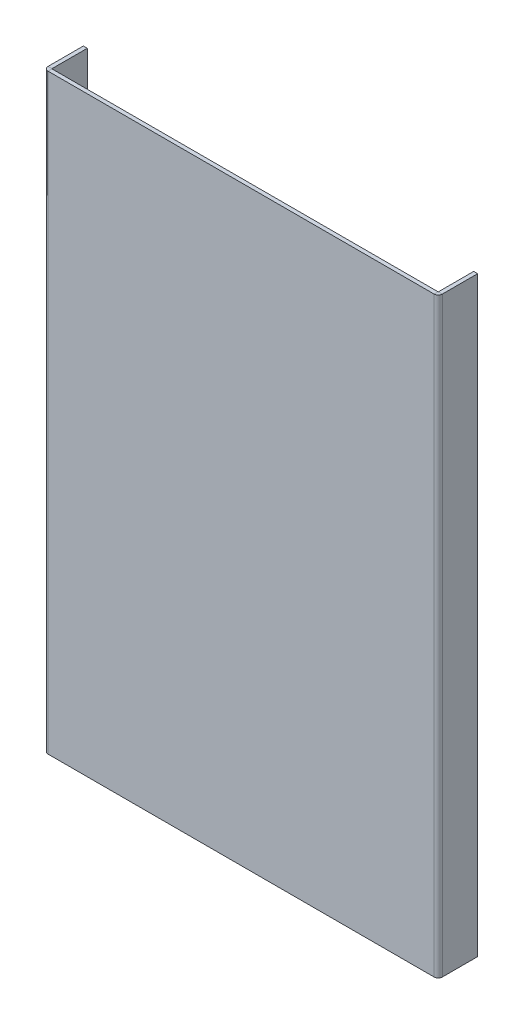
from build123d import *

# Parameters (mm, degrees)
SKETCH_1_W                         = 200
SKETCH_1_H                         = 300
SM_BASE_FLANGE_1_DEPTH             = 2
SM_EDGE_FLANGE_1_STRIP_W           = 8.2
SM_EDGE_FLANGE_1_STRIP_H           = 2
SM_EDGE_FLANGE_1_STRIP_CUT_DEPTH   = 300
SM_EDGE_FLANGE_1_STRIP_2_W         = 8.2
SM_EDGE_FLANGE_1_STRIP_2_H         = 2
SM_EDGE_FLANGE_1_STRIP_CUT_2_DEPTH = 300
SM_EDGE_FLANGE_1_DEPTH             = 300
SM_EDGE_FLANGE_1_BEND_DEPTH        = 300


# Sheet-metal steps are written as plain solids
with BuildPart() as part:
    # Sketch 1 → 基体-法兰1 (new body)
    with BuildSketch(Plane.XY):
        Rectangle(SKETCH_1_W, SKETCH_1_H)
    extrude(amount=-SM_BASE_FLANGE_1_DEPTH)

    # 边线-法兰1 strip (across the edge) → 边线-法兰1 strip cut (cut)
    with BuildSketch(Plane(origin=(100, 150, -2), x_dir=(-1, 0, 0), z_dir=(0, -1, 0))):
        with Locations((-2, -1)):
            Rectangle(SM_EDGE_FLANGE_1_STRIP_W, SM_EDGE_FLANGE_1_STRIP_H)
    extrude(amount=SM_EDGE_FLANGE_1_STRIP_CUT_DEPTH, mode=Mode.SUBTRACT)

    # 边线-法兰1 strip 2 (across the edge) → 边线-法兰1 strip cut 2 (cut)
    with BuildSketch(Plane(origin=(-100, -150, -2), x_dir=(1, 0, 0), z_dir=(0, 1, 0))):
        with Locations((-2, -1)):
            Rectangle(SM_EDGE_FLANGE_1_STRIP_2_W, SM_EDGE_FLANGE_1_STRIP_2_H)
    extrude(amount=SM_EDGE_FLANGE_1_STRIP_CUT_2_DEPTH, mode=Mode.SUBTRACT)

    # 边线-法兰1 section (across the edge) → 边线-法兰1 (add)
    with BuildSketch(Plane(origin=(100, 150, -2), x_dir=(-1, 0, 0), z_dir=(0, -1, 0))):
        with BuildLine():
            Line((0, 0.1), (0, 18))
            Line((0, 18), (2, 18))
            Line((2, 18), (2, 0.1))
            ThreePointArc((2, 0.1), (2.029289322, 0.029289322), (2.1, 0))
            Line((2.1, 0), (2.1, -2))
            ThreePointArc((2.1, -2), (0.61507576, -1.38492424), (0, 0.1))
        make_face()
    extrude(amount=SM_EDGE_FLANGE_1_DEPTH)

    # 边线-法兰1 section 2 (across the edge) → 边线-法兰1 bend (add)
    with BuildSketch(Plane(origin=(-100, -150, -2), x_dir=(1, 0, 0), z_dir=(0, 1, 0))):
        with BuildLine():
            Line((0, 0.1), (0, 18))
            Line((0, 18), (2, 18))
            Line((2, 18), (2, 0.1))
            ThreePointArc((2, 0.1), (2.029289322, 0.029289322), (2.1, 0))
            Line((2.1, 0), (2.1, -2))
            ThreePointArc((2.1, -2), (0.61507576, -1.38492424), (0, 0.1))
        make_face()
    extrude(amount=SM_EDGE_FLANGE_1_BEND_DEPTH)


solid = part.part
